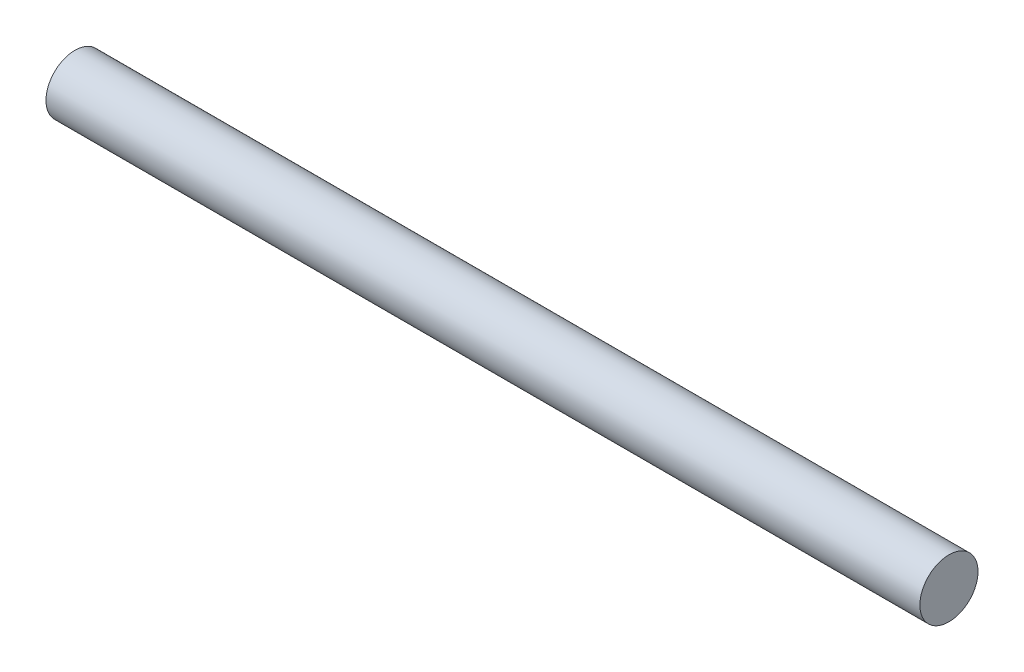
from build123d import *

# Parameters (mm, degrees)
SWEEP1_PROFILE_R = 20


with BuildPart() as part:
    # Sweep1: sweep along a path in Sketch1
    with BuildLine(Plane.XY) as sweep1_path:
        Line((0, 0), (601.545048496, 0))
    # Sweep1 profile (on start of the path) → Sweep1 (sweep)
    with BuildSketch(Plane(origin=(0, 0, 0), x_dir=(0, 0, 1), z_dir=(1, 0, 0))):
        Circle(SWEEP1_PROFILE_R)
    sweep(path=sweep1_path.line)


solid = part.part
